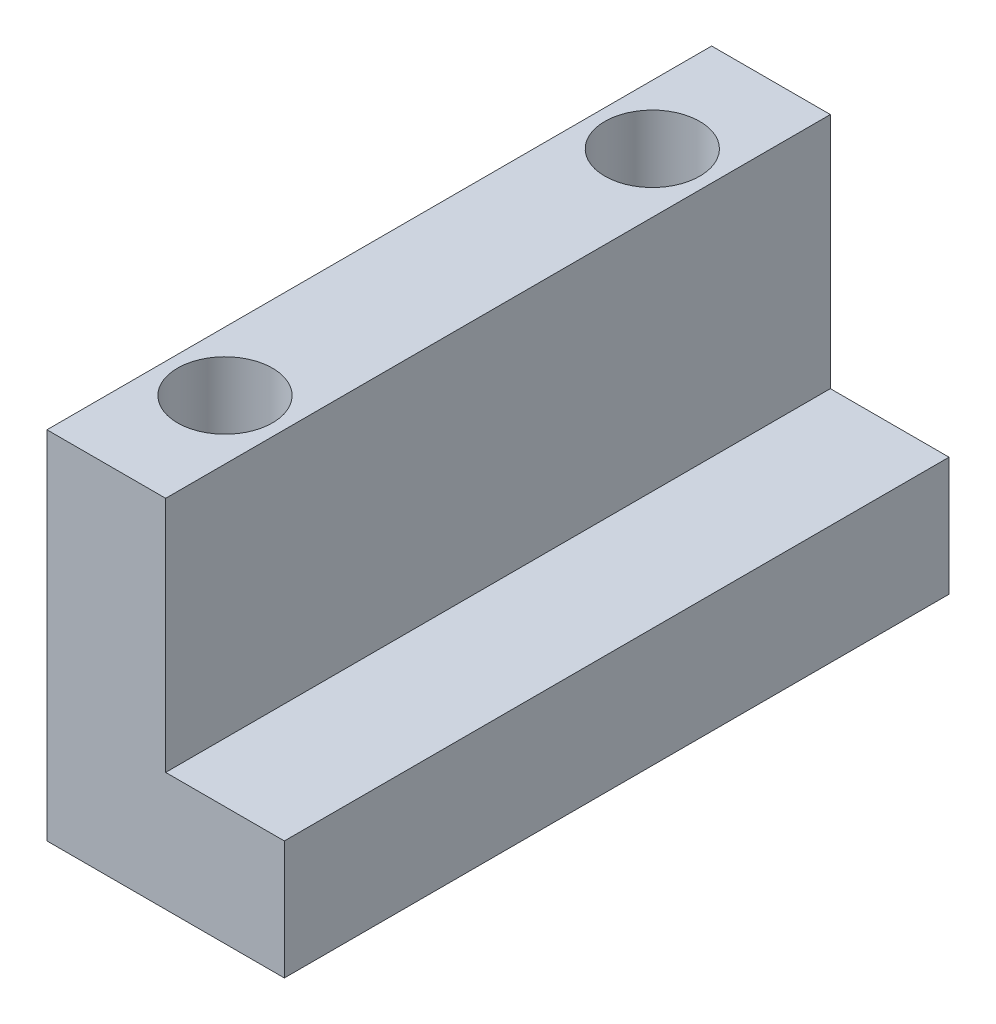
from build123d import *

# Parameters (mm, degrees)
BOSS_EXTRUDE1_DEPTH = 381
CUT_EXTRUDE1_REACH  = 383.687
SKETCH2_R           = 3.175
SKETCH3_R           = 2.54
CUT_EXTRUDE2_DEPTH  = 7.62
CUT_EXTRUDE3_START  = -7.62
SKETCH4_R           = 2.54
CUT_EXTRUDE3_DEPTH  = 7.62
SKETCH5_W           = 6.35
SKETCH5_H           = 6.35
CUT_EXTRUDE4_DEPTH  = 345.44
SKETCH7_W           = 345.44
SKETCH7_H           = 19.05
CUT_EXTRUDE5_DEPTH  = 382.528799699
SKETCH8_R           = 2.54
CUT_EXTRUDE6_DEPTH  = 43.293097546


with BuildPart() as part:
    # Sketch1 → Boss-Extrude1 (new body)
    with BuildSketch(Plane.XY):
        Polygon((0, 0), (-12.7, 0), (-12.7, 19.05), (-6.35, 19.05), (-6.35, 6.35), (0, 6.35), align=None)
    extrude(amount=-BOSS_EXTRUDE1_DEPTH)

    # Sketch2 → Cut-Extrude1 (cut, up to next)
    with BuildSketch(Plane.ZY.offset(12.7), mode=Mode.PRIVATE) as cut_extrude1_sk1:
        with Locations((-365.76, 12.065)):
            Circle(SKETCH2_R)
    cut_extrude1_tool1 = extrude(cut_extrude1_sk1.sketch, amount=-CUT_EXTRUDE1_REACH, mode=Mode.PRIVATE) & part.part
    add(cut_extrude1_tool1.solids().sort_by_distance((-12.7, 12.065, -365.76))[0], mode=Mode.SUBTRACT)

    # Sketch3 → Cut-Extrude2 (cut)
    with BuildSketch(Plane(origin=(0, 19.05, 0), x_dir=(1, 0, 0), z_dir=(0, 1, 0))):
        with Locations((-9.525, 6.35)):
            Circle(SKETCH3_R)
        with Locations((-9.525, 374.65)):
            Circle(SKETCH3_R)
    extrude(amount=-CUT_EXTRUDE2_DEPTH, mode=Mode.SUBTRACT)

    # Sketch4 → Cut-Extrude3 (cut)
    with BuildSketch(Plane.XZ.offset(CUT_EXTRUDE3_START)):
        with Locations((-9.525, -374.65)):
            Circle(SKETCH4_R)
        with Locations((-9.525, -6.35)):
            Circle(SKETCH4_R)
    extrude(amount=CUT_EXTRUDE3_DEPTH, mode=Mode.SUBTRACT)

    # Sketch5 → Cut-Extrude4 (cut)
    with BuildSketch(Plane(origin=(0, 0, -381), x_dir=(-1, 0, 0), z_dir=(0, 0, -1))):
        with Locations((3.175, 3.175)):
            Rectangle(SKETCH5_W, SKETCH5_H)
    extrude(amount=-CUT_EXTRUDE4_DEPTH, mode=Mode.SUBTRACT)

    # Sketch7 → Cut-Extrude5 (cut, through all)
    with BuildSketch(Plane(origin=(-6.35, 0, 0), x_dir=(0, 0, -1), z_dir=(1, 0, 0))):
        with Locations((208.28, 9.525)):
            Rectangle(SKETCH7_W, SKETCH7_H)
    extrude(amount=-CUT_EXTRUDE5_DEPTH, mode=Mode.SUBTRACT)

    # Sketch8 → Cut-Extrude6 (cut, through all)
    with BuildSketch(Plane(origin=(0, 19.05, 0), x_dir=(1, 0, 0), z_dir=(0, 1, 0))):
        with Locations((-9.525, 29.21)):
            Circle(SKETCH8_R)
    extrude(amount=-CUT_EXTRUDE6_DEPTH, mode=Mode.SUBTRACT)


solid = part.part
